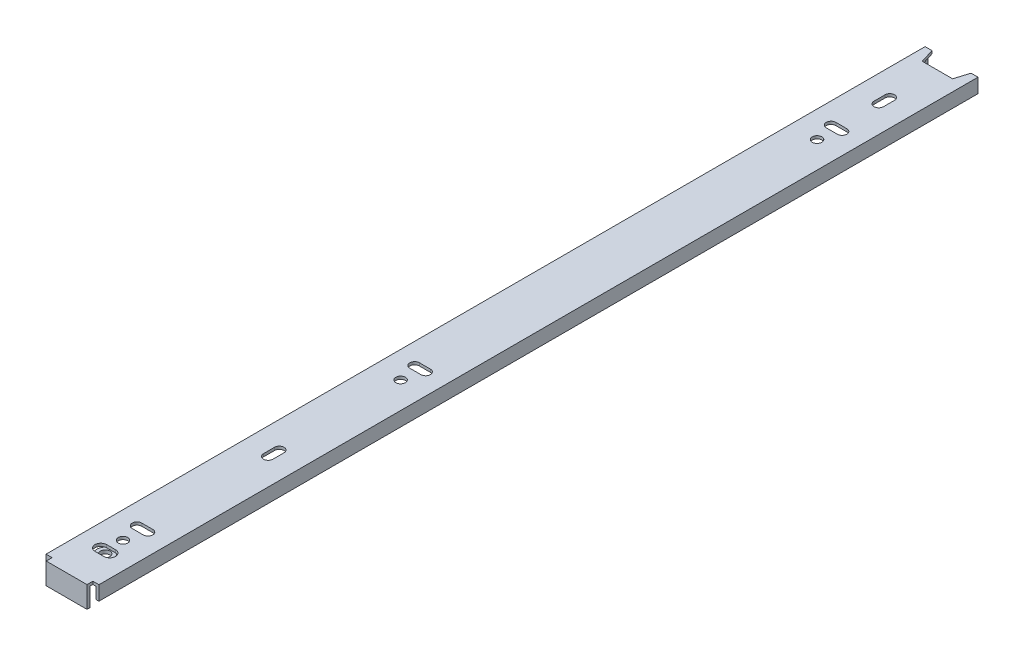
from build123d import *

# Parameters (mm, degrees)
BOSS_EXTRUDE1_DEPTH                              = 2.6
SKETCH2_W                                        = 24.4
SKETCH2_H                                        = 408
BOSS_EXTRUDE2_DEPTH                              = 1.3
SKETCH3_W                                        = 2.8
SKETCH3_H                                        = 2.7
CUT_EXTRUDE1_DEPTH                               = 409.200992159
SKETCH4_W                                        = 1.3
SKETCH4_H                                        = 405.3
BOSS_EXTRUDE3_DEPTH                              = 5.3
SKETCH5_W                                        = 2.8
SKETCH5_H                                        = 2.7
CUT_EXTRUDE2_DEPTH                               = 409.235716223
SKETCH6_W                                        = 1.3
SKETCH6_H                                        = 405.3
BOSS_EXTRUDE4_DEPTH                              = 5.3
SKETCH7_W                                        = 18.8
SKETCH7_H                                        = 1.4
BOSS_EXTRUDE5_DEPTH                              = 8.6
SKETCH8_W                                        = 14
SKETCH8_H                                        = 6.5
CUT_EXTRUDE3_DEPTH                               = 409.302400189
CUT_EXTRUDE4_DEPTH                               = 409.272947916
CUT_EXTRUDE5_DEPTH                               = 409.272947916
CUT_EXTRUDE6_DEPTH                               = 409.272947916
CUT_EXTRUDE7_DEPTH                               = 409.272947916
CUT_EXTRUDE8_DEPTH                               = 409.302400189
CUT_EXTRUDE9_DEPTH                               = 2.6
DRAFT1_ANGLE                                     = 17.102728969
F_4_4_4_4_DIAMETER_HOLE1_D                       = 4.4
CBORE_FOR_M4_HEX_HEAD_MACHINE_SCREW1_D           = 4.4
CBORE_FOR_M4_HEX_HEAD_MACHINE_SCREW1_DEPTH       = 3.9
CBORE_FOR_M4_HEX_HEAD_MACHINE_SCREW1_CBORE_D     = 7.5
CBORE_FOR_M4_HEX_HEAD_MACHINE_SCREW1_CBORE_DEPTH = 1


with BuildPart() as part:
    # Sketch1 → Boss-Extrude1 (new body)
    with BuildSketch(Plane.XZ.offset(0.6)):
        with BuildLine():
            Line((3.75, 390.2), (3.140289704, 397.947144852))
            ThreePointArc((3.140289704, 397.947144852), (0, 400.85), (-3.140289704, 397.947144852))
            Line((-3.140289704, 397.947144852), (-3.75, 390.2))
            ThreePointArc((-3.75, 390.2), (0, 386.45), (3.75, 390.2))
        make_face()
    extrude(amount=-BOSS_EXTRUDE1_DEPTH)

    # Sketch2 → Boss-Extrude2 (add)
    with BuildSketch(Plane.XZ.offset(-2)):
        with Locations((0, 204)):
            Rectangle(SKETCH2_W, SKETCH2_H)
        with BuildLine():
            Line((-2.05, 392.9), (2.05, 392.9))
            ThreePointArc((2.05, 392.9), (4.75, 390.2), (2.05, 387.5))
            Line((2.05, 387.5), (-2.05, 387.5))
            ThreePointArc((-2.05, 387.5), (-4.75, 390.2), (-2.05, 392.9))
        make_face(mode=Mode.SUBTRACT)
    extrude(amount=-BOSS_EXTRUDE2_DEPTH)

    # Sketch3 → Cut-Extrude1 (cut, through all)
    with BuildSketch(Plane(origin=(0, 3.3, 0), x_dir=(-1, 0, 0), z_dir=(0, 1, 0))):
        with Locations((-10.8, 406.65)):
            Rectangle(SKETCH3_W, SKETCH3_H)
    extrude(amount=-CUT_EXTRUDE1_DEPTH, mode=Mode.SUBTRACT)

    # Sketch4 → Boss-Extrude3 (add)
    with BuildSketch(Plane.XZ.offset(-2)):
        with Locations((11.55, 202.65)):
            Rectangle(SKETCH4_W, SKETCH4_H)
    extrude(amount=BOSS_EXTRUDE3_DEPTH)

    # Sketch5 → Cut-Extrude2 (cut, through all)
    with BuildSketch(Plane(origin=(0, 3.3, 0), x_dir=(-1, 0, 0), z_dir=(0, 1, 0))):
        with Locations((10.8, 406.65)):
            Rectangle(SKETCH5_W, SKETCH5_H)
    extrude(amount=-CUT_EXTRUDE2_DEPTH, mode=Mode.SUBTRACT)

    # Sketch6 → Boss-Extrude4 (add)
    with BuildSketch(Plane.XZ.offset(-2)):
        with Locations((-11.55, 202.65)):
            Rectangle(SKETCH6_W, SKETCH6_H)
    extrude(amount=BOSS_EXTRUDE4_DEPTH)

    # Sketch7 → Boss-Extrude5 (add)
    with BuildSketch(Plane.XZ.offset(-2)):
        with Locations((0, 407.3)):
            Rectangle(SKETCH7_W, SKETCH7_H)
    extrude(amount=BOSS_EXTRUDE5_DEPTH)

    # Sketch8 → Cut-Extrude3 (cut, through all)
    with BuildSketch(Plane(origin=(0, 3.3, 0), x_dir=(-1, 0, 0), z_dir=(0, 1, 0))):
        with Locations((0, 3.25)):
            Rectangle(SKETCH8_W, SKETCH8_H)
    extrude(amount=-CUT_EXTRUDE3_DEPTH, mode=Mode.SUBTRACT)

    # Sketch9 → Cut-Extrude4 (cut, through all)
    with BuildSketch(Plane.XZ.offset(-2)):
        with BuildLine():
            Line((2.55, 375.200000014), (-2.55, 375.200000014))
            ThreePointArc((-2.55, 375.200000014), (-4.75, 373.000000014), (-2.55, 370.800000014))
            Line((-2.55, 370.800000014), (2.55, 370.800000014))
            ThreePointArc((2.55, 370.800000014), (4.75, 373.000000014), (2.55, 375.200000014))
        make_face()
    extrude(amount=-CUT_EXTRUDE4_DEPTH, mode=Mode.SUBTRACT)

    # Sketch10 → Cut-Extrude5 (cut, through all)
    with BuildSketch(Plane.XZ.offset(-2)):
        with BuildLine():
            Line((-2.549860329, 242.799983225), (2.550139671, 242.8))
            ThreePointArc((2.550139671, 242.8), (4.750132435, 245.000007236), (2.550125198, 247.2))
            Line((2.550125198, 247.2), (-2.549874802, 247.199983225))
            ThreePointArc((-2.549874802, 247.199983225), (-4.749867565, 244.999975989), (-2.549860329, 242.799983225))
        make_face()
    extrude(amount=-CUT_EXTRUDE5_DEPTH, mode=Mode.SUBTRACT)

    # Sketch11 → Cut-Extrude6 (cut, through all)
    with BuildSketch(Plane.XZ.offset(-2)):
        with BuildLine():
            Line((2.200125198, 309.95), (2.200125198, 315.05))
            ThreePointArc((2.200125198, 315.05), (0.000125198, 317.25), (-2.199874802, 315.05))
            Line((-2.199874802, 315.05), (-2.199874802, 309.95))
            ThreePointArc((-2.199874802, 309.95), (0.000125198, 307.75), (2.200125198, 309.95))
        make_face()
    extrude(amount=-CUT_EXTRUDE6_DEPTH, mode=Mode.SUBTRACT)

    # Sketch12 → Cut-Extrude7 (cut, through all)
    with BuildSketch(Plane.XZ.offset(-2)):
        with BuildLine():
            Line((2.200125198, 28.45), (2.200125198, 33.55))
            ThreePointArc((2.200125198, 33.55), (0.000125198, 35.75), (-2.199874802, 33.55))
            Line((-2.199874802, 33.55), (-2.199874802, 28.45))
            ThreePointArc((-2.199874802, 28.45), (0.000125198, 26.25), (2.200125198, 28.45))
        make_face()
    extrude(amount=-CUT_EXTRUDE7_DEPTH, mode=Mode.SUBTRACT)

    # Sketch13 → Cut-Extrude8 (cut, through all)
    with BuildSketch(Plane(origin=(0, 3.3, 0), x_dir=(-1, 0, 0), z_dir=(0, 1, 0))):
        with BuildLine():
            Line((2.549874802, 55.2), (-2.550125198, 55.2))
            ThreePointArc((-2.550125198, 55.2), (-4.750125198, 53), (-2.550125198, 50.8))
            Line((-2.550125198, 50.8), (2.549874802, 50.8))
            ThreePointArc((2.549874802, 50.8), (4.749874802, 53), (2.549874802, 55.2))
        make_face()
    extrude(amount=-CUT_EXTRUDE8_DEPTH, mode=Mode.SUBTRACT)

    # Sketch14 → Cut-Extrude9 (cut)
    with BuildSketch(Plane.XZ.offset(0.6)):
        Polygon((0.6, 397.1), (2.2, 397.1), (2.2, 398.3), (0.6, 398.3), (0.6, 399.9), (-0.6, 399.9), (-0.6, 398.3), (-2.2, 398.3), (-2.2, 397.1), (-0.6, 397.1), (-0.6, 395.5), (0.6, 395.5), align=None)
    extrude(amount=-CUT_EXTRUDE9_DEPTH, mode=Mode.SUBTRACT)

    # Draft1
    draft1_faces = [part.faces().sort_by_distance(p)[0] for p in [
        (-7, 2.65, 3.25),
        (7, 2.65, 3.25),
    ]]
    draft(draft1_faces, Plane(origin=(-7, -6.6, 6.5), x_dir=(0, -1, 0), z_dir=(0, 0, -1)), DRAFT1_ANGLE)

    # Ø4.4 (4.4) Diameter Hole1 (through all)
    with Locations(Plane(origin=(0, 2, 0), x_dir=(-1, 0, 0), z_dir=(0, -1, 0))):
        with Locations((-0.000125198, -62), (-0.000125198, -254), (0, -382)):
            Hole(F_4_4_4_4_DIAMETER_HOLE1_D / 2)

    # CBORE for M4 Hex Head Machine Screw1
    with Locations(Plane(origin=(0, -0.6, 0), x_dir=(-1, 0, 0), z_dir=(0, -1, 0))):
        with Locations((0, -390.2)):
            CounterBoreHole(CBORE_FOR_M4_HEX_HEAD_MACHINE_SCREW1_D / 2, CBORE_FOR_M4_HEX_HEAD_MACHINE_SCREW1_CBORE_D / 2, CBORE_FOR_M4_HEX_HEAD_MACHINE_SCREW1_CBORE_DEPTH, depth=CBORE_FOR_M4_HEX_HEAD_MACHINE_SCREW1_DEPTH)


solid = part.part
